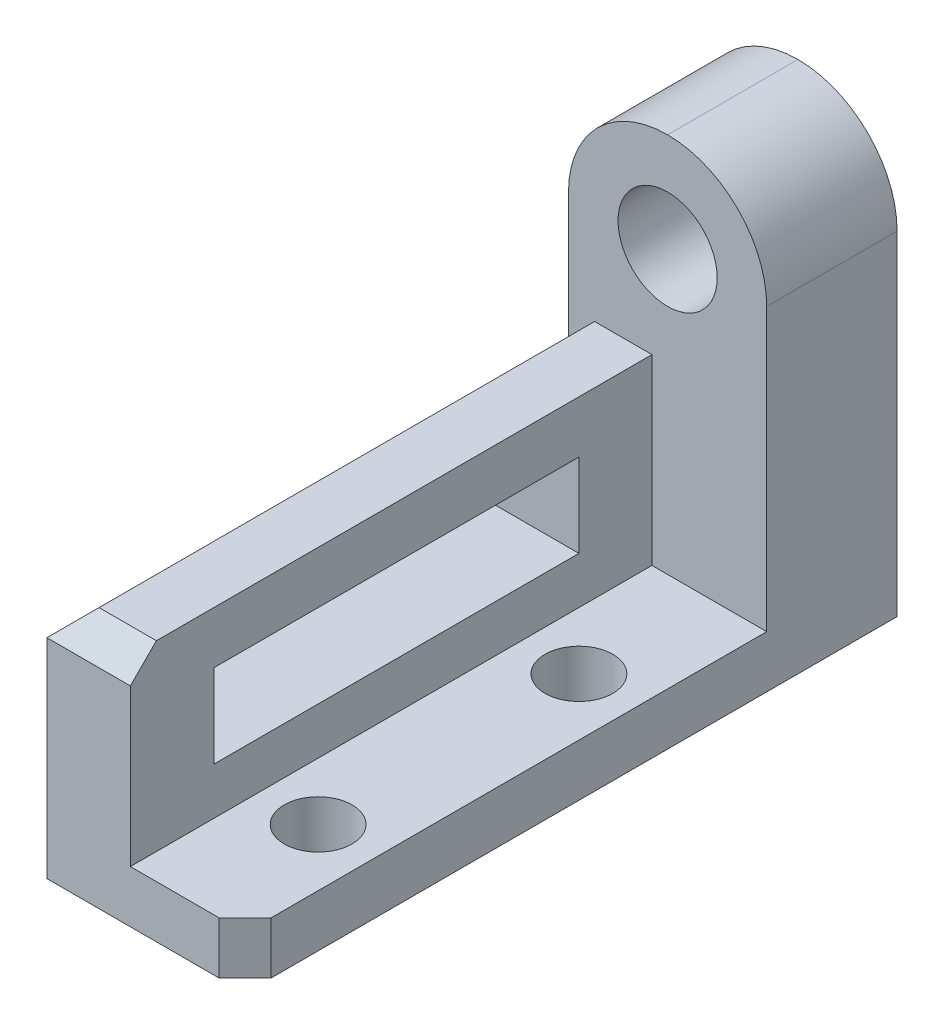
from build123d import *

# Parameters (mm, degrees)
BOSS_EXTRUDE1_DEPTH      = 19
BOSS_EXTRUDE1_DEPTH_BACK = 19
SKETCH2_W                = 16
SKETCH2_H                = 35
BOSS_EXTRUDE2_DEPTH      = 100
FILLET1_R                = 19
HOLE1_D                  = 19
CHAMFER1_SIZE            = 5
CHAMFER2_SIZE            = 5
SKETCH6_W                = 70
SKETCH6_H                = 16
CUT_EXTRUDE1_DEPTH       = 19
HOLE2_D                  = 13


with BuildPart() as part:
    # Sketch1 → Boss-Extrude1 (new, two sides: drawn at the far end of the back side and taken through both)
    with BuildSketch(Plane(origin=(0, 0, 0), x_dir=(0, 0, -1), z_dir=(1, 0, 0)).offset(-BOSS_EXTRUDE1_DEPTH_BACK)):
        Polygon((-62.5, 0), (62.5, 0), (62.5, 83), (37.5, 83), (37.5, 10), (-62.5, 10), align=None)
    extrude(amount=BOSS_EXTRUDE1_DEPTH + BOSS_EXTRUDE1_DEPTH_BACK)

    # Sketch2 → Boss-Extrude2 (add)
    with BuildSketch(Plane.XY.offset(-37.5)):
        with Locations((-11, 27.5)):
            Rectangle(SKETCH2_W, SKETCH2_H)
    extrude(amount=BOSS_EXTRUDE2_DEPTH)

    # Fillet1
    fillet1_edges = [part.edges().sort_by_distance(p)[0] for p in [
        (-19, 83, -50),
        (19, 83, -50),
    ]]
    fillet(fillet1_edges, radius=FILLET1_R - 0.0001)  # a hair under: the kernel refuses the full size

    # Hole1 (through all)
    with Locations(Plane.XY.offset(-37.5)):
        with Locations((0, 64)):
            Hole(HOLE1_D / 2)

    # Chamfer1
    chamfer1_edges = [part.edges().sort_by_distance(p)[0] for p in [
        (-19, 45, 12.5),
        (-11, 45, 62.5),
    ]]
    chamfer(chamfer1_edges, length=CHAMFER1_SIZE)

    # Chamfer2
    chamfer2_edges = [part.edges().sort_by_distance(p)[0] for p in [
        (19, 5, 62.5),
    ]]
    chamfer(chamfer2_edges, length=CHAMFER2_SIZE)

    # Sketch6 → Cut-Extrude1 (cut)
    with BuildSketch(Plane(origin=(-3, 0, 0), x_dir=(0, 0, -1), z_dir=(1, 0, 0))):
        with Locations((-11.5, 27)):
            Rectangle(SKETCH6_W, SKETCH6_H)
    extrude(amount=-CUT_EXTRUDE1_DEPTH, mode=Mode.SUBTRACT)

    # Hole2 (through all)
    with Locations(Plane(origin=(0, 10, 0), x_dir=(1, 0, 0), z_dir=(0, 1, 0))):
        with Locations((8, 12.5), (8, -37.5)):
            Hole(HOLE2_D / 2)


solid = part.part
